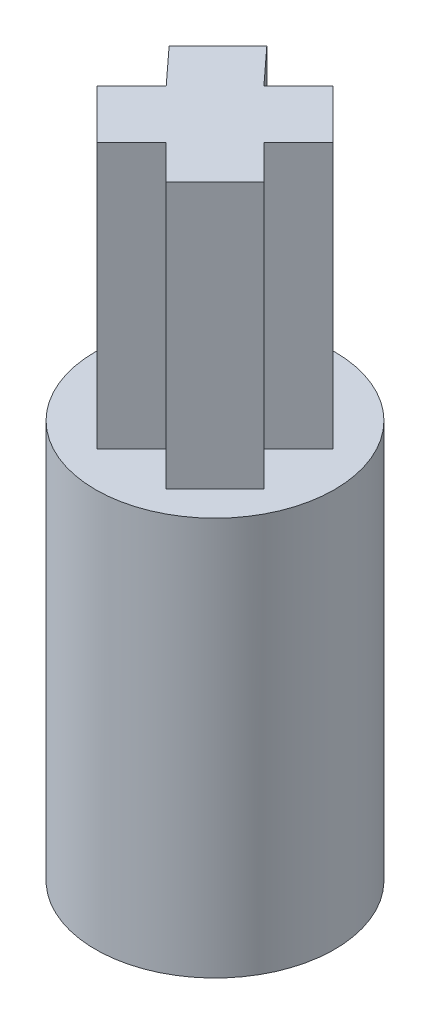
from build123d import *

# Parameters (mm, degrees)
SKETCH1_R           = 5.715
BOSS_EXTRUDE1_DEPTH = 6.35
BOSS_EXTRUDE2_START = 12.7
SKETCH3_R           = 5.715
BOSS_EXTRUDE2_DEPTH = 12.7
CUT_EXTRUDE1_DEPTH  = 12.7
BOSS_EXTRUDE3_DEPTH = 12.7


with BuildPart() as part:
    # Sketch1 → Boss-Extrude1 (new body)
    with BuildSketch(Plane(origin=(0, 0, 0), x_dir=(1, 0, 0), z_dir=(0, 1, 0))):
        Circle(SKETCH1_R)
    extrude(amount=BOSS_EXTRUDE1_DEPTH)

    # Sketch3 → Boss-Extrude2 (add)
    with BuildSketch(Plane(origin=(0, 0, 0), x_dir=(-1, 0, 0), z_dir=(0, -1, 0)).offset(BOSS_EXTRUDE2_START)):
        Circle(SKETCH3_R)
    extrude(amount=-BOSS_EXTRUDE2_DEPTH)

    # Sketch4 → Cut-Extrude1 (cut)
    with BuildSketch(Plane.XZ.offset(12.7)):
        Polygon((0, 2.54), (-1.796051224, 4.336051224), (-4.336051224, 1.796051224), (-2.54, 0), (-4.336051224, -1.796051224), (-1.796051224, -4.336051224), (0, -2.54), (1.796051224, -4.336051224), (4.336051224, -1.796051224), (2.54, 0), (4.336051224, 1.796051224), (1.796051224, 4.336051224), align=None)
    extrude(amount=-CUT_EXTRUDE1_DEPTH, mode=Mode.SUBTRACT)

    # Sketch5 → Boss-Extrude3 (add)
    with BuildSketch(Plane(origin=(0, 6.35, 0), x_dir=(1, 0, 0), z_dir=(0, 1, 0))):
        Polygon((2.685e-06, 2.339735302), (1.655603957, 3.988861939), (3.990936726, 1.650595629), (2.3368, 0), (3.989167126, -1.652367126), (1.652367126, -3.989167126), (0, -2.3368), (-1.653404588, -3.98813026), (-3.988737357, -1.64986395), (-2.3368, 0.002932835), (-3.918102081, 1.723432172), (-1.581302081, 4.060232172), align=None)
    extrude(amount=BOSS_EXTRUDE3_DEPTH)


solid = part.part
